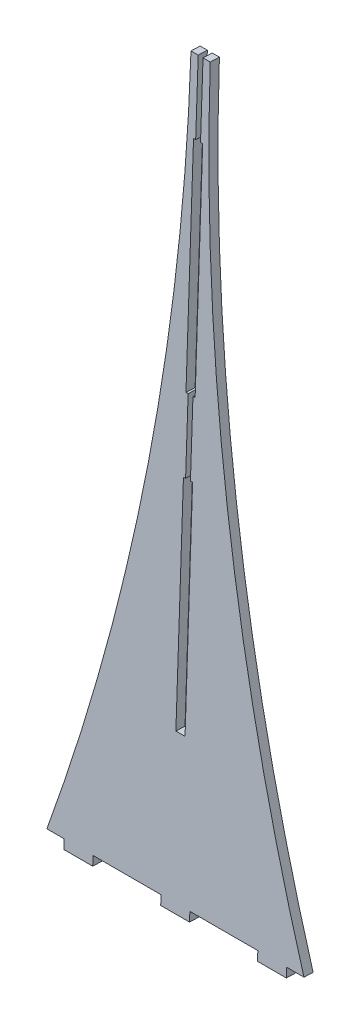
from build123d import *

# Parameters (mm, degrees)
BOSS_EXTRUDE1_DEPTH = 3.175


with BuildPart() as part:
    # Sketch1 → Boss-Extrude1 (new body)
    with BuildSketch(Plane(origin=(0, -2.422329102, -69.308356399), x_dir=(-1, 0, 0), z_dir=(0, -0.03492870325036369, -0.9993898066766782))):
        with BuildLine():
            ThreePointArc((44.57145678, 79.214647081), (13.715159098, 202.525816485), (3.3375, 329.214647081))
            Line((3.3375, 329.214647081), (0.8375, 329.214647081))
            Line((0.8375, 329.214647081), (0.8375, 304.214647081))
            Line((0.8375, 304.214647081), (1.5875, 304.214647081))
            Line((1.5875, 304.214647081), (1.5875, 229.214647081))
            Line((1.5875, 229.214647081), (0.8375, 229.214647081))
            Line((0.8375, 229.214647081), (0.8375, 204.214647081))
            Line((0.8375, 204.214647081), (1.5875, 204.214647081))
            Line((1.5875, 204.214647081), (1.5875, 129.214647081))
            Line((1.5875, 129.214647081), (-1.5875, 129.214647081))
            Line((-1.5875, 129.214647081), (-1.5875, 204.214647081))
            Line((-1.5875, 204.214647081), (-0.8375, 204.214647081))
            Line((-0.8375, 204.214647081), (-0.8375, 229.214647081))
            Line((-0.8375, 229.214647081), (-1.5875, 229.214647081))
            Line((-1.5875, 229.214647081), (-1.5875, 304.214647081))
            Line((-1.5875, 304.214647081), (-0.8375, 304.214647081))
            Line((-0.8375, 304.214647081), (-0.8375, 329.214647081))
            Line((-0.8375, 329.214647081), (-3.3375, 329.214647081))
            ThreePointArc((-3.3375, 329.214647081), (-13.715159098, 202.525816485), (-44.57145678, 79.214647081))
            Line((-44.57145678, 79.214647081), (-38.57145678, 79.214647081))
            Line((-38.57145678, 79.214647081), (-38.57145678, 76.039647081))
            Line((-38.57145678, 76.039647081), (-28.57145678, 76.039647081))
            Line((-28.57145678, 76.039647081), (-28.57145678, 79.214647081))
            Line((-28.57145678, 79.214647081), (-5, 79.214647081))
            Line((-5, 79.214647081), (-5, 76.039647081))
            Line((-5, 76.039647081), (5, 76.039647081))
            Line((5, 76.039647081), (5, 79.214647081))
            Line((5, 79.214647081), (28.57145678, 79.214647081))
            Line((28.57145678, 79.214647081), (28.57145678, 76.039647081))
            Line((28.57145678, 76.039647081), (38.57145678, 76.039647081))
            Line((38.57145678, 76.039647081), (38.57145678, 79.214647081))
            Line((38.57145678, 79.214647081), (44.57145678, 79.214647081))
        make_face()
    extrude(amount=BOSS_EXTRUDE1_DEPTH)


solid = part.part
